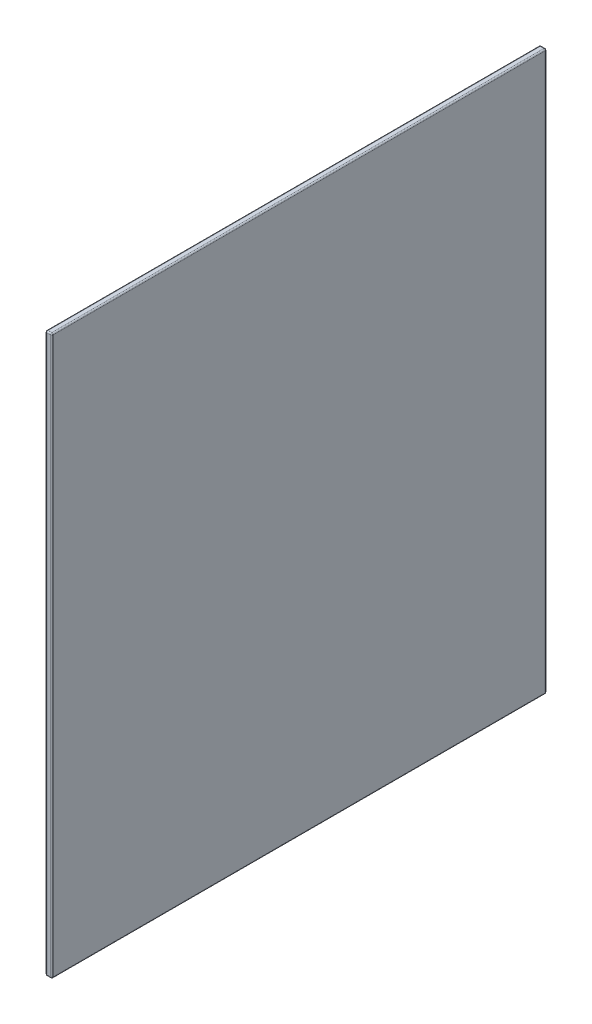
from build123d import *

# Parameters (mm, degrees)
SKETCH1_W           = 368.3
SKETCH1_H           = 415.925
BOSS_EXTRUDE1_DEPTH = 4.7625
FILLET1_R           = 1.016
FILLET2_R           = 1.016


with BuildPart() as part:
    # Sketch1 → Boss-Extrude1 (new body)
    with BuildSketch(Plane(origin=(0, 0, 0), x_dir=(0, 0, -1), z_dir=(1, 0, 0))):
        Rectangle(SKETCH1_W, SKETCH1_H)
    extrude(amount=BOSS_EXTRUDE1_DEPTH)

    # Fillet1
    fillet1_edges = [part.edges().sort_by_distance(p)[0] for p in [
        (4.7625, 0, 184.15),
        (4.7625, -207.9625, 0),
        (4.7625, 0, -184.15),
        (0, -207.9625, 0),
        (0, 0, 184.15),
        (0, 207.9625, 0),
        (0, 0, -184.15),
        (4.7625, 207.9625, 0),
    ]]
    fillet(fillet1_edges, radius=FILLET1_R)

    # Fillet2
    # the kernel refuses this fillet: 1.016 mm, written as the material it takes off along each edge
    with BuildSketch(Plane(origin=(1.016, -206.9465, -183.134), x_dir=(0, 0, -1), z_dir=(0, -1, 0))) as fillet2_piece_1_section:
        Polygon((0, 0), (FILLET2_R, 0), (FILLET2_R, -FILLET2_R), (0, -FILLET2_R), align=None)
    fillet2_piece_1 = extrude(amount=FILLET2_R, mode=Mode.PRIVATE)
    fillet2_piece_1 = fillet2_piece_1 - Plane(origin=(1.016, -206.9465, -183.134), x_dir=(0.7071067811865475, 0, 0.7071067811865475), z_dir=(0, -1, 0)) * Sphere(FILLET2_R, mode=Mode.PRIVATE)
    add(fillet2_piece_1, mode=Mode.SUBTRACT)
    with BuildSketch(Plane(origin=(1.016, -206.9465, 183.134), x_dir=(0, 0, 1), z_dir=(0, -1, 0))) as fillet2_piece_2_section:
        Polygon((0, 0), (FILLET2_R, 0), (FILLET2_R, FILLET2_R), (0, FILLET2_R), align=None)
    fillet2_piece_2 = extrude(amount=FILLET2_R, mode=Mode.PRIVATE)
    fillet2_piece_2 = fillet2_piece_2 - Plane(origin=(1.016, -206.9465, 183.134), x_dir=(0.7071067811865475, 0, -0.7071067811865475), z_dir=(0, -1, 0)) * Sphere(FILLET2_R, mode=Mode.PRIVATE)
    add(fillet2_piece_2, mode=Mode.SUBTRACT)
    with BuildSketch(Plane(origin=(1.016, 206.9465, -183.134), x_dir=(0, 1, 0), z_dir=(0, 0, -1))) as fillet2_piece_3_section:
        Polygon((0, 0), (FILLET2_R, 0), (FILLET2_R, -FILLET2_R), (0, -FILLET2_R), align=None)
    fillet2_piece_3 = extrude(amount=FILLET2_R, mode=Mode.PRIVATE)
    fillet2_piece_3 = fillet2_piece_3 - Plane(origin=(1.016, 206.9465, -183.134), x_dir=(0.7071067811865475, -0.7071067811865475, 0), z_dir=(0, 0, -1)) * Sphere(FILLET2_R, mode=Mode.PRIVATE)
    add(fillet2_piece_3, mode=Mode.SUBTRACT)
    with BuildSketch(Plane(origin=(1.016, 206.9465, 183.134), x_dir=(0, 1, 0), z_dir=(0, 0, 1))) as fillet2_piece_4_section:
        Polygon((0, 0), (FILLET2_R, 0), (FILLET2_R, FILLET2_R), (0, FILLET2_R), align=None)
    fillet2_piece_4 = extrude(amount=FILLET2_R, mode=Mode.PRIVATE)
    fillet2_piece_4 = fillet2_piece_4 - Plane(origin=(1.016, 206.9465, 183.134), x_dir=(0.7071067811865475, -0.7071067811865475, 0), z_dir=(0, 0, 1)) * Sphere(FILLET2_R, mode=Mode.PRIVATE)
    add(fillet2_piece_4, mode=Mode.SUBTRACT)
    with BuildSketch(Plane(origin=(3.7465, 206.9465, 183.134), x_dir=(0, 1, 0), z_dir=(0, 0, 1))) as fillet2_piece_5_section:
        Polygon((0, 0), (FILLET2_R, 0), (FILLET2_R, -FILLET2_R), (0, -FILLET2_R), align=None)
    fillet2_piece_5 = extrude(amount=FILLET2_R, mode=Mode.PRIVATE)
    fillet2_piece_5 = fillet2_piece_5 - Plane(origin=(3.7465, 206.9465, 183.134), x_dir=(-0.7071067811865475, -0.7071067811865475, 0), z_dir=(0, 0, 1)) * Sphere(FILLET2_R, mode=Mode.PRIVATE)
    add(fillet2_piece_5, mode=Mode.SUBTRACT)
    with BuildSketch(Plane(origin=(3.7465, 206.9465, -183.134), x_dir=(0, 1, 0), z_dir=(0, 0, -1))) as fillet2_piece_6_section:
        Polygon((0, 0), (FILLET2_R, 0), (FILLET2_R, FILLET2_R), (0, FILLET2_R), align=None)
    fillet2_piece_6 = extrude(amount=FILLET2_R, mode=Mode.PRIVATE)
    fillet2_piece_6 = fillet2_piece_6 - Plane(origin=(3.7465, 206.9465, -183.134), x_dir=(-0.7071067811865475, -0.7071067811865475, 0), z_dir=(0, 0, -1)) * Sphere(FILLET2_R, mode=Mode.PRIVATE)
    add(fillet2_piece_6, mode=Mode.SUBTRACT)
    with BuildSketch(Plane(origin=(3.7465, -206.9465, 183.134), x_dir=(0, 0, 1), z_dir=(0, -1, 0))) as fillet2_piece_7_section:
        Polygon((0, 0), (FILLET2_R, 0), (FILLET2_R, -FILLET2_R), (0, -FILLET2_R), align=None)
    fillet2_piece_7 = extrude(amount=FILLET2_R, mode=Mode.PRIVATE)
    fillet2_piece_7 = fillet2_piece_7 - Plane(origin=(3.7465, -206.9465, 183.134), x_dir=(-0.7071067811865475, 0, -0.7071067811865475), z_dir=(0, -1, 0)) * Sphere(FILLET2_R, mode=Mode.PRIVATE)
    add(fillet2_piece_7, mode=Mode.SUBTRACT)
    with BuildSketch(Plane(origin=(3.7465, -206.9465, -183.134), x_dir=(0, 0, -1), z_dir=(0, -1, 0))) as fillet2_piece_8_section:
        Polygon((0, 0), (FILLET2_R, 0), (FILLET2_R, FILLET2_R), (0, FILLET2_R), align=None)
    fillet2_piece_8 = extrude(amount=FILLET2_R, mode=Mode.PRIVATE)
    fillet2_piece_8 = fillet2_piece_8 - Plane(origin=(3.7465, -206.9465, -183.134), x_dir=(-0.7071067811865475, 0, 0.7071067811865475), z_dir=(0, -1, 0)) * Sphere(FILLET2_R, mode=Mode.PRIVATE)
    add(fillet2_piece_8, mode=Mode.SUBTRACT)
    with BuildSketch(Plane(origin=(1.016, 207.9625, 184.15), x_dir=(0, -1, 0), z_dir=(1, 0, 0)), Plane(origin=(1.016, -207.9625, 184.15), x_dir=(0, 0, -1), z_dir=(1, 0, 0))) as fillet2_piece_9:
        with BuildLine():
            CenterArc((FILLET2_R, FILLET2_R), FILLET2_R, 180, 90)
            Line((0, FILLET2_R), (0, 0))
            Line((0, 0), (FILLET2_R, 0))
        make_face()
    extrude(amount=2.7305, mode=Mode.SUBTRACT)
    with BuildSketch(Plane(origin=(1.016, 207.9625, -184.15), x_dir=(0, -1, 0), z_dir=(1, 0, 0)), Plane(origin=(1.016, -207.9625, -184.15), x_dir=(0, 0, 1), z_dir=(1, 0, 0))) as fillet2_piece_10:
        with BuildLine():
            CenterArc((FILLET2_R, -FILLET2_R), FILLET2_R, 90, 90)
            Line((0, -FILLET2_R), (0, 0))
            Line((0, 0), (FILLET2_R, 0))
        make_face()
    extrude(amount=2.7305, mode=Mode.SUBTRACT)


solid = part.part
